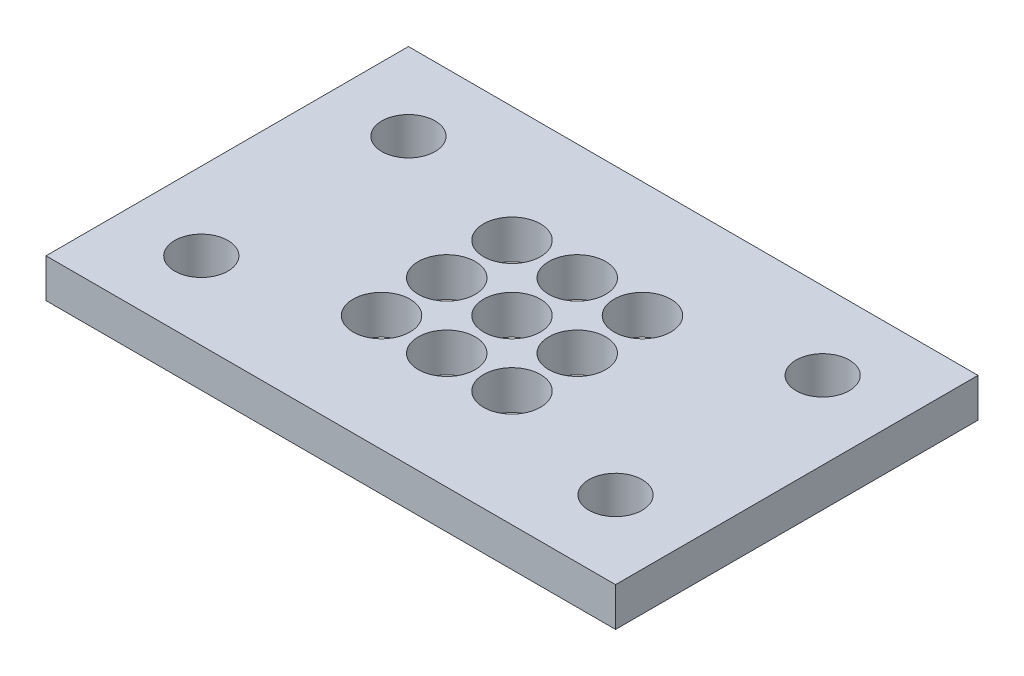
from build123d import *

# Parameters (mm, degrees)
SKETCH1_W           = 69.85
SKETCH1_H           = 44.45
SKETCH1_R           = 3.2639
SKETCH1_R_2         = 3.4925
BOSS_EXTRUDE1_DEPTH = 4.7625


with BuildPart() as part:
    # Sketch1 → Boss-Extrude1 (new body)
    with BuildSketch(Plane(origin=(0, 0, 0), x_dir=(1, 0, 0), z_dir=(0, 1, 0))):
        with Locations((34.925, 22.225)):
            Rectangle(SKETCH1_W, SKETCH1_H)
        with Locations((9.525, 9.525)):
            Circle(SKETCH1_R, mode=Mode.SUBTRACT)
        with Locations((26.925, 14.225)):
            Circle(SKETCH1_R_2, mode=Mode.SUBTRACT)
        with Locations((26.925, 22.225)):
            Circle(SKETCH1_R_2, mode=Mode.SUBTRACT)
        with Locations((60.325, 9.525)):
            Circle(SKETCH1_R, mode=Mode.SUBTRACT)
        with Locations((34.925, 14.225)):
            Circle(SKETCH1_R_2, mode=Mode.SUBTRACT)
        with Locations((42.925, 14.225)):
            Circle(SKETCH1_R_2, mode=Mode.SUBTRACT)
        with Locations((26.925, 30.225)):
            Circle(SKETCH1_R_2, mode=Mode.SUBTRACT)
        with Locations((34.925, 30.225)):
            Circle(SKETCH1_R_2, mode=Mode.SUBTRACT)
        with Locations((9.525, 34.925)):
            Circle(SKETCH1_R, mode=Mode.SUBTRACT)
        with Locations((34.925, 22.225)):
            Circle(SKETCH1_R_2, mode=Mode.SUBTRACT)
        with Locations((42.925, 22.225)):
            Circle(SKETCH1_R_2, mode=Mode.SUBTRACT)
        with Locations((42.925, 30.225)):
            Circle(SKETCH1_R_2, mode=Mode.SUBTRACT)
        with Locations((60.325, 34.925)):
            Circle(SKETCH1_R, mode=Mode.SUBTRACT)
    extrude(amount=BOSS_EXTRUDE1_DEPTH)


solid = part.part
